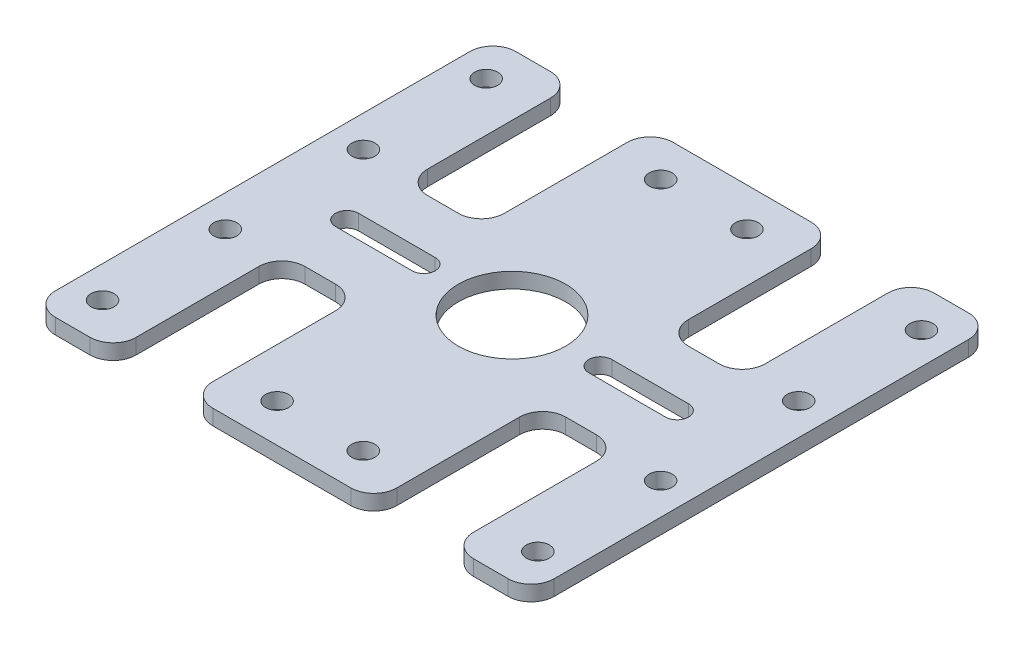
from build123d import *

# Parameters (mm, degrees)
SKETCH_1_W               = 65
SKETCH_1_H               = 60
EXTRUDE_1_DEPTH          = 2
SKETCH_2_R               = 1.5
CUT_EXTRUDE_1_DEPTH      = 2
SKETCH_3_R               = 1.5
CUT_EXTRUDE_2_DEPTH      = 45.274710615
MIRROR_2_COPY_1_SKETCH_R = 1.5
MIRROR_2_COPY_1_DEPTH    = 2
MIRROR_2_COPY_2_SKETCH_R = 1.5
MIRROR_2_COPY_2_DEPTH    = 45.274710615
SKETCH_4_W               = 10
SKETCH_4_H               = 34
CUT_EXTRUDE_3_DEPTH      = 45.274710615
MIRROR_4_COPY_1_SKETCH_W = 10
MIRROR_4_COPY_1_SKETCH_H = 34
MIRROR_4_COPY_1_DEPTH    = 45.274710615
SKETCH_5_R               = 7
CUT_EXTRUDE_4_DEPTH      = 45.274710615
FILLET_1_R               = 3
MIRROR_6_DEPTH           = 2
SKETCH_6_R               = 1.5
CUT_EXTRUDE_5_DEPTH      = 45.274710615
CUT_EXTRUDE_6_DEPTH      = 45.274710615
MIRROR_8_COPY_1_SKETCH_R = 1.5
MIRROR_8_COPY_1_DEPTH    = 45.274710615
FILLET_2_R               = 3


# Read off the part's stored shape, not the designer's step: 镜向6
with BuildPart() as part:
    # 草图1 → 凸台-拉伸1 (new body)
    with BuildSketch(Plane(origin=(0, 0, 0), x_dir=(1, 0, 0), z_dir=(0, 1, 0))):
        Rectangle(SKETCH_1_W, SKETCH_1_H)
    extrude(amount=EXTRUDE_1_DEPTH)

    # 草图2 → 切除-拉伸1 (cut)
    with BuildSketch(Plane(origin=(0, 2, 0), x_dir=(1, 0, 0), z_dir=(0, 1, 0))):
        with Locations(Location((-28.367832783, 25, 0), (0, 0, 270))):
            Circle(SKETCH_2_R)
    cut_extrude_1 = extrude(amount=-CUT_EXTRUDE_1_DEPTH, mode=Mode.SUBTRACT)

    # 草图3 → 切除-拉伸2 (cut, through all)
    with BuildSketch(Plane(origin=(0, 2, 0), x_dir=(1, 0, 0), z_dir=(0, 1, 0))):
        with Locations(Location((-5.617832783, 25, 0), (0, 0, 270))):
            Circle(SKETCH_3_R)
    cut_extrude_2 = extrude(amount=-CUT_EXTRUDE_2_DEPTH, mode=Mode.SUBTRACT)

    # 镜向1: 切除-拉伸1, 切除-拉伸2 across plane
    add(cut_extrude_1.mirror(Plane(origin=(0, 0, 0), x_dir=(0, 0, 1), z_dir=(1, 0, 0))), mode=Mode.SUBTRACT)
    add(cut_extrude_2.mirror(Plane(origin=(0, 0, 0), x_dir=(0, 0, 1), z_dir=(1, 0, 0))), mode=Mode.SUBTRACT)

    # 镜向2: 切除-拉伸1, 切除-拉伸2 across plane
    add(cut_extrude_1.mirror(Plane.XY), mode=Mode.SUBTRACT)
    add(cut_extrude_2.mirror(Plane.XY), mode=Mode.SUBTRACT)

    # 镜向2 copy 1 sketch → 镜向2 copy 1 (cut)
    with BuildSketch(Plane(origin=(0, 2, 0), x_dir=(-1, 0, 0), z_dir=(0, 1, 0))):
        with Locations(Location((-28.367832783, 25, 0), (0, 0, 270))):
            Circle(MIRROR_2_COPY_1_SKETCH_R)
    extrude(amount=-MIRROR_2_COPY_1_DEPTH, mode=Mode.SUBTRACT)

    # 镜向2 copy 2 sketch → 镜向2 copy 2 (cut, through all)
    with BuildSketch(Plane(origin=(0, 2, 0), x_dir=(-1, 0, 0), z_dir=(0, 1, 0))):
        with Locations(Location((-5.617832783, 25, 0), (0, 0, 270))):
            Circle(MIRROR_2_COPY_2_SKETCH_R)
    extrude(amount=-MIRROR_2_COPY_2_DEPTH, mode=Mode.SUBTRACT)

    # 草图4 → 切除-拉伸3 (cut, through all)
    with BuildSketch(Plane(origin=(0, 2, 0), x_dir=(1, 0, 0), z_dir=(0, 1, 0))):
        with Locations((-16.992832783, 25)):
            Rectangle(SKETCH_4_W, SKETCH_4_H)
    cut_extrude_3 = extrude(amount=-CUT_EXTRUDE_3_DEPTH, mode=Mode.SUBTRACT)

    # 镜向3: 切除-拉伸3 across plane
    add(cut_extrude_3.mirror(Plane.XY), mode=Mode.SUBTRACT)

    # 镜向4: 切除-拉伸3 across plane
    add(cut_extrude_3.mirror(Plane(origin=(0, 0, 0), x_dir=(0, 0, 1), z_dir=(1, 0, 0))), mode=Mode.SUBTRACT)

    # 镜向4 copy 1 sketch → 镜向4 copy 1 (cut, through all)
    with BuildSketch(Plane(origin=(0, 2, 0), x_dir=(-1, 0, 0), z_dir=(0, 1, 0))):
        with Locations((-16.992832783, 25)):
            Rectangle(MIRROR_4_COPY_1_SKETCH_W, MIRROR_4_COPY_1_SKETCH_H)
    extrude(amount=-MIRROR_4_COPY_1_DEPTH, mode=Mode.SUBTRACT)

    # 草图5 → 切除-拉伸4 (cut, through all)
    with BuildSketch(Plane(origin=(0, 2, 0), x_dir=(1, 0, 0), z_dir=(0, 1, 0))):
        with Locations(Location((0, 0, 0), (0, 0, 270))):
            Circle(SKETCH_5_R)
    extrude(amount=-CUT_EXTRUDE_4_DEPTH, mode=Mode.SUBTRACT)

    # 圆角1
    fillet_1_edges = [part.edges().sort_by_distance(p)[0] for p in [
        (-21.992832783, 1, 30),
        (-11.992832783, 1, 30),
        (32.5, 1, 30),
        (-32.5, 1, 30),
        (21.992832783, 1, 30),
        (11.992832783, 1, 30),
    ]]
    fillet(fillet_1_edges, radius=FILLET_1_R)

    # 镜向6 outline → 镜向6 (cut)
    with BuildSketch(Plane(origin=(0, 0, 0), x_dir=(1, 0, 0), z_dir=(0, 1, 0))):
        with BuildLine():
            Line((-11.992832783, 30), (-11.992832783, 27))
            ThreePointArc((-11.992832783, 27), (-11.114153127, 29.121320343), (-8.992832783, 30))
            Line((-8.992832783, 30), (-11.992832783, 30))
        make_face()
        with BuildLine():
            Line((11.992832783, 30), (8.992832783, 30))
            ThreePointArc((8.992832783, 30), (11.114153127, 29.121320343), (11.992832783, 27))
            Line((11.992832783, 27), (11.992832783, 30))
        make_face()
        with BuildLine():
            Line((32.5, 30), (29.5, 30))
            ThreePointArc((29.5, 30), (31.621320344, 29.121320344), (32.5, 27))
            Line((32.5, 27), (32.5, 30))
        make_face()
        with BuildLine():
            ThreePointArc((21.992832783, 27), (22.871512439, 29.121320344), (24.992832783, 30))
            Line((24.992832783, 30), (21.992832783, 30))
            Line((21.992832783, 30), (21.992832783, 27))
        make_face()
        with BuildLine():
            ThreePointArc((-32.5, 27), (-31.621320344, 29.121320344), (-29.5, 30))
            Line((-29.5, 30), (-32.5, 30))
            Line((-32.5, 30), (-32.5, 27))
        make_face()
        with BuildLine():
            ThreePointArc((-24.992832783, 30), (-22.871512439, 29.121320344), (-21.992832783, 27))
            Line((-21.992832783, 27), (-21.992832783, 30))
            Line((-21.992832783, 30), (-24.992832783, 30))
        make_face()
    extrude(amount=MIRROR_6_DEPTH, mode=Mode.SUBTRACT)

    # 草图6 → 切除-拉伸5 (cut, through all)
    with BuildSketch(Plane(origin=(0, 2, 0), x_dir=(1, 0, 0), z_dir=(0, 1, 0))):
        with Locations(Location((-28.367832783, -9, 0), (0, 0, 270))):
            Circle(SKETCH_6_R)
    cut_extrude_5 = extrude(amount=-CUT_EXTRUDE_5_DEPTH, mode=Mode.SUBTRACT)

    # 镜向7: 切除-拉伸5 across plane
    add(cut_extrude_5.mirror(Plane.XY), mode=Mode.SUBTRACT)

    # 草图7 → 切除-拉伸6 (cut, through all)
    with BuildSketch(Plane(origin=(0, 2, 0), x_dir=(1, 0, 0), z_dir=(0, 1, 0))):
        with BuildLine():
            Line((-11.509285997, 1.5), (-21.509285997, 1.5))
            ThreePointArc((-21.509285997, 1.5), (-23.009285997, 0), (-21.509285997, -1.5))
            Line((-21.509285997, -1.5), (-11.509285997, -1.5))
            ThreePointArc((-11.509285997, -1.5), (-10.009285997, 0), (-11.509285997, 1.5))
        make_face()
    cut_extrude_6 = extrude(amount=-CUT_EXTRUDE_6_DEPTH, mode=Mode.SUBTRACT)

    # 镜向8: 切除-拉伸5, 切除-拉伸6 across plane
    add(cut_extrude_5.mirror(Plane(origin=(0, 0, 0), x_dir=(0, 0, 1), z_dir=(1, 0, 0))), mode=Mode.SUBTRACT)
    add(cut_extrude_6.mirror(Plane(origin=(0, 0, 0), x_dir=(0, 0, 1), z_dir=(1, 0, 0))), mode=Mode.SUBTRACT)

    # 镜向8 copy 1 sketch → 镜向8 copy 1 (cut, through all)
    with BuildSketch(Plane(origin=(0, 2, 0), x_dir=(-1, 0, 0), z_dir=(0, 1, 0))):
        with Locations(Location((-28.367832783, -9, 0), (0, 0, 270))):
            Circle(MIRROR_8_COPY_1_SKETCH_R)
    extrude(amount=-MIRROR_8_COPY_1_DEPTH, mode=Mode.SUBTRACT)

    # 圆角2
    fillet_2_edges = [part.edges().sort_by_distance(p)[0] for p in [
        (11.992832783, 1, -8),
        (21.992832783, 1, -8),
        (-21.992832783, 1, -8),
        (-11.992832783, 1, -8),
        (-11.992832783, 1, 8),
        (-21.992832783, 1, 8),
        (21.992832783, 1, 8),
        (11.992832783, 1, 8),
    ]]
    fillet(fillet_2_edges, radius=FILLET_2_R)


solid = part.part
